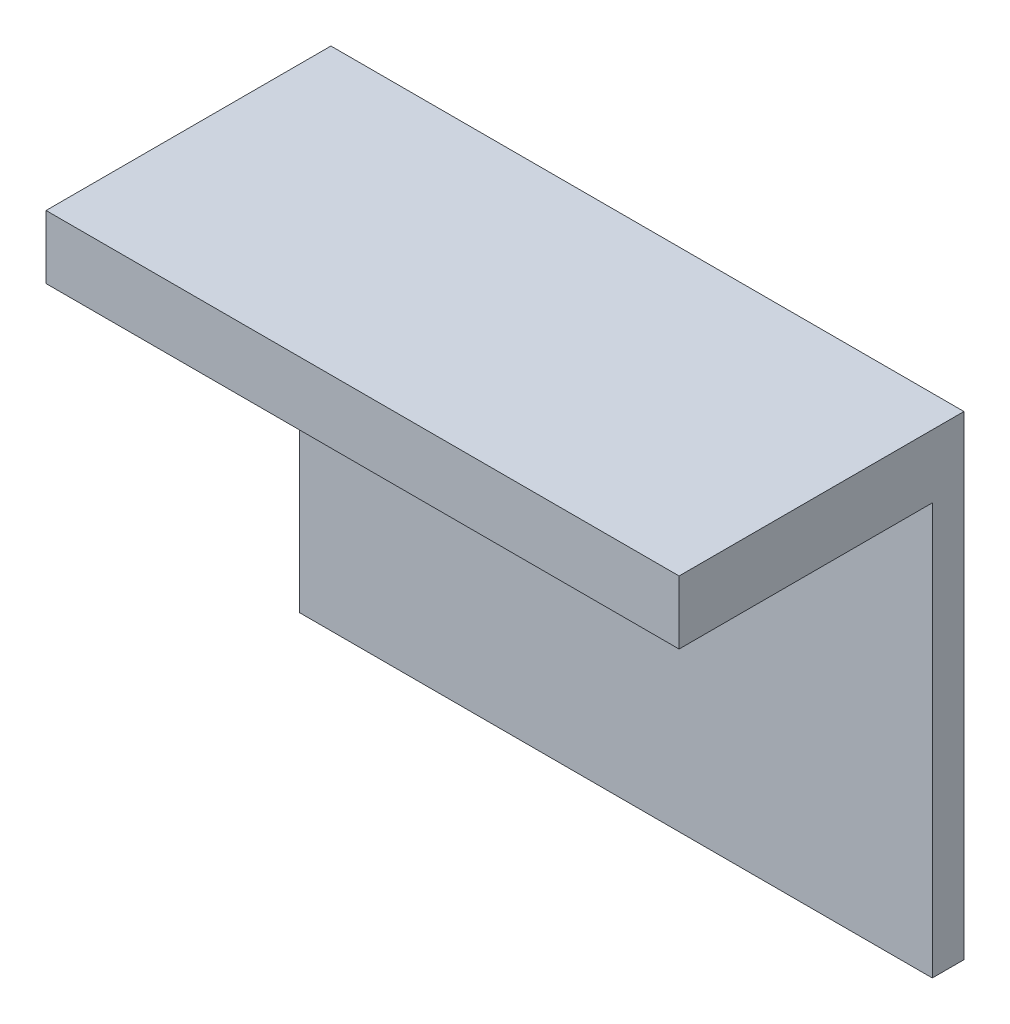
from build123d import *

# Parameters (mm, degrees)
ESBO_O1_W                = 20
ESBO_O1_H                = 15
RESSALTO_EXTRUS_O1_DEPTH = 0.5
ESBO_O2_W                = 20
ESBO_O2_H                = 2
RESSALTO_EXTRUS_O2_DEPTH = 8
CORTE_EXTRUS_O1_DEPTH    = 0.5


with BuildPart() as part:
    # Esboço1 → Ressalto-extrusão1 (new, symmetric)
    with BuildSketch(Plane.XY):
        Rectangle(ESBO_O1_W, ESBO_O1_H)
    extrude(amount=RESSALTO_EXTRUS_O1_DEPTH, both=True)

    # Esboço2 → Ressalto-extrusão2 (add)
    with BuildSketch(Plane.XY.offset(0.5)):
        with Locations((0, 6.5)):
            Rectangle(ESBO_O2_W, ESBO_O2_H)
    extrude(amount=RESSALTO_EXTRUS_O2_DEPTH)

    # Esboço3 → Corte-extrusão1 (cut)
    # profile 1 of 6: a face of its own
    with BuildSketch(Plane(origin=(0, 0, -0.5), x_dir=(-1, 0, 0), z_dir=(0, 0, -1))):
        Polygon((-7.583333333, 3.5), (-5.878205128, 3.5), (-5.878205128, 3.141025641), (-7.269230769, 3.141025641), (-7.269230769, 2.064102564), (-5.878205128, 2.064102564), (-5.878205128, 1.705128205), (-7.269230769, 1.705128205), (-7.269230769, 0), (-7.583333333, 0), align=None)
    # profile 2 of 6: a face of its own
    with BuildSketch(Plane(origin=(0, 0, -0.5), x_dir=(-1, 0, 0), z_dir=(0, 0, -1))):
        with BuildLine():
            Line((-5.25, 3.5), (-4.549579327, 3.5))
            add(Edge.make_bspline(
                [(-4.549579327, 3.5), (-4.502838198, 3.499844414), (-4.413090054, 3.499545672), (-4.284516784, 3.497879909), (-4.167689687, 3.493105553), (-4.062669847, 3.48899697), (-3.969459192, 3.481505028), (-3.887771902, 3.474344381), (-3.817984204, 3.46497072), (-3.775738353, 3.456265297), (-3.756610577, 3.452323718)],
                knots=[0, 0, 0, 0, 1.410062039, 2.707475311, 3.878576406, 4.937260626, 5.877586885, 6.699081471, 7.410979367, 8, 8, 8, 8], degree=3))
            add(Edge.make_bspline(
                [(-3.756610577, 3.452323718), (-3.731003953, 3.445996953), (-3.680336963, 3.433478389), (-3.607386897, 3.407018788), (-3.537872573, 3.376399163), (-3.472082749, 3.340435443), (-3.410346958, 3.298860663), (-3.352028647, 3.252392541), (-3.296863184, 3.201285335), (-3.247081553, 3.144250494), (-3.200142502, 3.084413984), (-3.160553875, 3.019710227), (-3.126427396, 2.9520487), (-3.099256879, 2.880741282), (-3.077378905, 2.80647951), (-3.061952666, 2.728590713), (-3.052701478, 2.647429738), (-3.051759623, 2.59207183), (-3.051282051, 2.564002404)],
                knots=[0, 0, 0, 0, 1.027469482, 2.033020251, 3.019912614, 3.986113645, 4.951240523, 5.91722682, 6.890402269, 7.87763091, 8.8651537, 9.85103654, 10.82876324, 11.815024772, 12.821070561, 13.842952187, 14.906261191, 16, 16, 16, 16], degree=3))
            add(Edge.make_bspline(
                [(-3.051282051, 2.564002404), (-3.052751049, 2.517367299), (-3.055617445, 2.426370131), (-3.082342549, 2.29430925), (-3.126119069, 2.171119935), (-3.186442358, 2.056957297), (-3.263261833, 1.954046652), (-3.355586624, 1.863656197), (-3.463468236, 1.788016284), (-3.563897552, 1.735563479), (-3.652611752, 1.701970571), (-3.725645064, 1.678334212), (-3.805312042, 1.660072247), (-3.890849376, 1.643712115), (-3.982613032, 1.63136042), (-4.080383071, 1.622313826), (-4.184229223, 1.616659777), (-4.255568292, 1.615817772), (-4.292267628, 1.615384615)],
                knots=[0, 0, 0, 0, 1.260483769, 2.459530307, 3.627416485, 4.787058657, 5.939039949, 7.08810263, 8.267026773, 9.491475466, 10.141966685, 10.831826277, 11.566392101, 12.351337768, 13.187381173, 14.07005841, 15.007169909, 16, 16, 16, 16], degree=3))
            Line((-4.292267628, 1.615384615), (-3.006410256, 0))
            Line((-3.006410256, 0), (-3.394831731, 0))
            Line((-3.394831731, 0), (-4.680689103, 1.615384615))
            Line((-4.680689103, 1.615384615), (-4.935897436, 1.615384615))
            Line((-4.935897436, 1.615384615), (-4.935897436, 0))
            Line((-4.935897436, 0), (-5.25, 0))
            Line((-5.25, 0), (-5.25, 3.5))
        make_face()
        with BuildLine():
            Line((-4.935897436, 3.141025641), (-4.935897436, 1.974358974))
            Line((-4.935897436, 1.974358974), (-4.295072115, 1.969451122))
            add(Edge.make_bspline(
                [(-4.295072115, 1.969451122), (-4.265152076, 1.969437885), (-4.207158519, 1.969412229), (-4.123257855, 1.973406005), (-4.045137743, 1.977949323), (-3.973096991, 1.984898669), (-3.907103415, 1.99385474), (-3.847190002, 2.005057725), (-3.79325895, 2.018109787), (-3.730360412, 2.038311413), (-3.66012388, 2.070317431), (-3.583792421, 2.11688293), (-3.518790083, 2.175452049), (-3.463872221, 2.242425505), (-3.419742789, 2.316061754), (-3.388630735, 2.395478123), (-3.368888292, 2.478669721), (-3.366559747, 2.535847829), (-3.365384615, 2.564703526)],
                knots=[0, 0, 0, 0, 1.146690395, 2.22261258, 3.21895312, 4.145990853, 4.996080663, 5.770904154, 6.481378293, 7.121626537, 8.300444488, 9.431385265, 10.535395872, 11.636531494, 12.74115979, 13.810798291, 14.895190096, 16, 16, 16, 16], degree=3))
            add(Edge.make_bspline(
                [(-3.365384615, 2.564703526), (-3.366586736, 2.592850099), (-3.368968902, 2.648626338), (-3.38841767, 2.730282248), (-3.421307052, 2.807349198), (-3.46562929, 2.879513683), (-3.519628445, 2.945019419), (-3.582946257, 3.001066572), (-3.653851452, 3.047316037), (-3.720122651, 3.076870418), (-3.779356863, 3.094990271), (-3.830786523, 3.107741435), (-3.888898001, 3.117985904), (-3.95397346, 3.126193964), (-4.02573509, 3.133248909), (-4.104545742, 3.138000687), (-4.189882522, 3.140814551), (-4.249029453, 3.14095364), (-4.279647436, 3.141025641)],
                knots=[0, 0, 0, 0, 1.101028733, 2.181837193, 3.264309656, 4.369019818, 5.486613113, 6.575447106, 7.666700264, 8.788928104, 9.402425223, 10.0903467, 10.862060571, 11.710948788, 12.657782767, 13.684531032, 14.801375019, 16, 16, 16, 16], degree=3))
            Line((-4.279647436, 3.141025641), (-4.935897436, 3.141025641))
        make_face(mode=Mode.SUBTRACT)
    # profile 3 of 6: a face of its own
    with BuildSketch(Plane(origin=(0, 0, -0.5), x_dir=(-1, 0, 0), z_dir=(0, 0, -1))):
        Polygon((-2.288461538, 3.5), (-0.314102564, 3.5), (-0.314102564, 3.141025641), (-1.974358974, 3.141025641), (-1.974358974, 2.064102564), (-0.314102564, 2.064102564), (-0.314102564, 1.705128205), (-1.974358974, 1.705128205), (-1.974358974, 0.358974359), (-0.314102564, 0.358974359), (-0.314102564, 0), (-2.288461538, 0), align=None)
    # profile 4 of 6: a face of its own
    with BuildSketch(Plane(origin=(0, 0, -0.5), x_dir=(-1, 0, 0), z_dir=(0, 0, -1))):
        Polygon((0.314102564, 0), (0.314102564, 3.5), (0.380008013, 3.5), (2.692307692, 0.745292468), (2.692307692, 3.5), (3.006410256, 3.5), (3.006410256, 0), (2.934895833, 0), (0.628205128, 2.748397436), (0.628205128, 0), align=None)
    # profile 5 of 6: a face of its own
    with BuildSketch(Plane(origin=(0, 0, -0.5), x_dir=(-1, 0, 0), z_dir=(0, 0, -1))):
        Polygon((3.5, 3.141025641), (3.5, 3.5), (5.33974359, 3.5), (5.33974359, 3.141025641), (4.576923077, 3.141025641), (4.576923077, 0), (4.262820513, 0), (4.262820513, 3.141025641), align=None)
    # profile 6 of 6: a face of its own
    with BuildSketch(Plane(origin=(0, 0, -0.5), x_dir=(-1, 0, 0), z_dir=(0, 0, -1))):
        Polygon((5.878205128, 3.5), (7.852564103, 3.5), (7.852564103, 3.141025641), (6.192307692, 3.141025641), (6.192307692, 2.064102564), (7.852564103, 2.064102564), (7.852564103, 1.705128205), (6.192307692, 1.705128205), (6.192307692, 0.358974359), (7.852564103, 0.358974359), (7.852564103, 0), (5.878205128, 0), align=None)
    extrude(amount=-CORTE_EXTRUS_O1_DEPTH, mode=Mode.SUBTRACT)


solid = part.part
